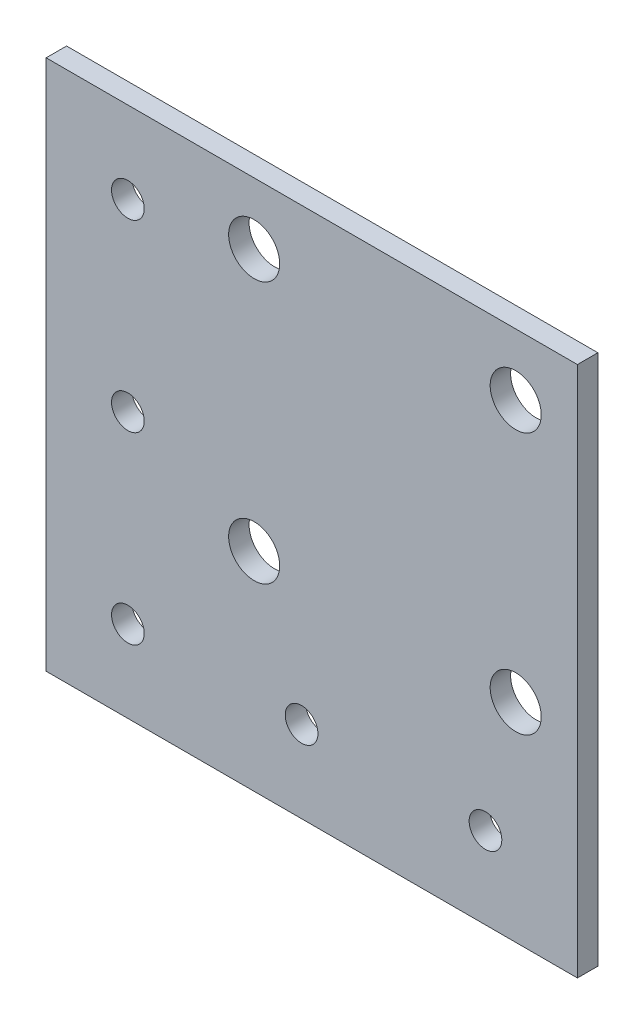
from build123d import *

# Parameters (mm, degrees)
SKETCH_1_W      = 130
SKETCH_1_H      = 130
SKETCH_1_R      = 4
SKETCH_1_R_2    = 6.25
EXTRUDE_1_DEPTH = 5


with BuildPart() as part:
    # 草图1 → 凸台-拉伸1 (new body)
    with BuildSketch(Plane.XY):
        with Locations((-17.9, -17.9)):
            Rectangle(SKETCH_1_W, SKETCH_1_H)
        with Locations((-62.9, -62.9)):
            Circle(SKETCH_1_R, mode=Mode.SUBTRACT)
        with Locations((-20.4, -62.9)):
            Circle(SKETCH_1_R, mode=Mode.SUBTRACT)
        with Locations((-32, -32)):
            Circle(SKETCH_1_R_2, mode=Mode.SUBTRACT)
        with Locations((24.6, -62.9)):
            Circle(SKETCH_1_R, mode=Mode.SUBTRACT)
        with Locations((32, -32)):
            Circle(SKETCH_1_R_2, mode=Mode.SUBTRACT)
        with Locations((-62.9, -17.9)):
            Circle(SKETCH_1_R, mode=Mode.SUBTRACT)
        with Locations((-62.9, 27.1)):
            Circle(SKETCH_1_R, mode=Mode.SUBTRACT)
        with Locations((-32, 32)):
            Circle(SKETCH_1_R_2, mode=Mode.SUBTRACT)
        with Locations((32, 32)):
            Circle(SKETCH_1_R_2, mode=Mode.SUBTRACT)
    extrude(amount=EXTRUDE_1_DEPTH)


solid = part.part
